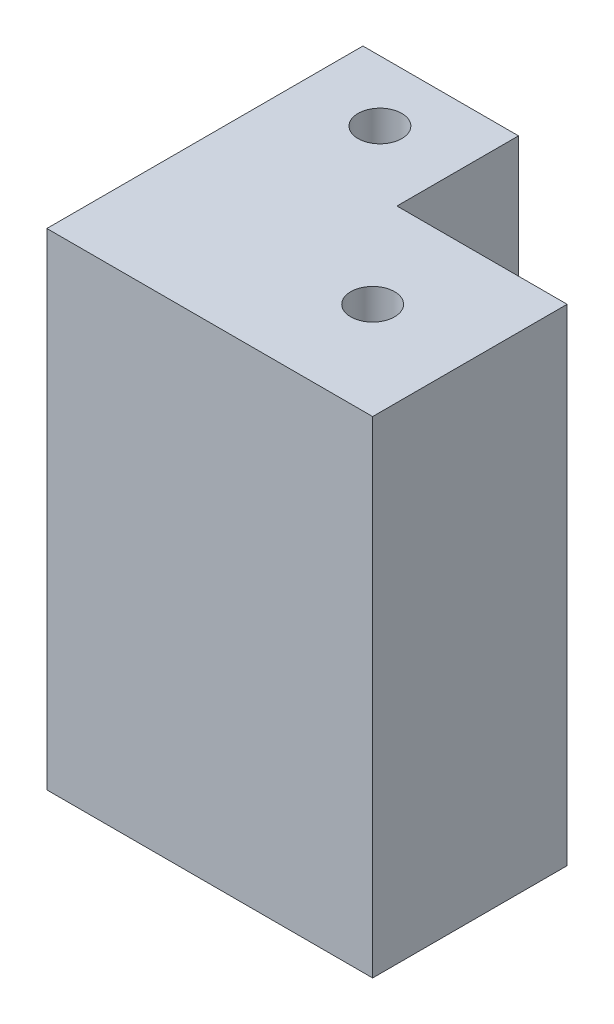
from build123d import *

# Parameters (mm, degrees)
SKETCH1_R                               = 4.5
BOSS_EXTRUDE1_DEPTH                     = 100
CBORE_FOR_M5_HEX_HEAD_BOLT2_D           = 13.5
CBORE_FOR_M5_HEX_HEAD_BOLT2_DEPTH       = 23.85
CBORE_FOR_M5_HEX_HEAD_BOLT2_CBORE_D     = 32
CBORE_FOR_M5_HEX_HEAD_BOLT2_CBORE_DEPTH = 5
CBORE_FOR_M5_HEX_HEAD_BOLT3_D           = 10.2
CBORE_FOR_M5_HEX_HEAD_BOLT3_DEPTH       = 13.5
CBORE_FOR_M5_HEX_HEAD_BOLT3_CBORE_D     = 22
CBORE_FOR_M5_HEX_HEAD_BOLT3_CBORE_DEPTH = 3.5


with BuildPart() as part:
    # Sketch1 → Boss-Extrude1 (new body)
    with BuildSketch(Plane(origin=(0, 0, 0), x_dir=(1, 0, 0), z_dir=(0, 1, 0))):
        Polygon((0, 0), (0, 25), (-32, 25), (-32, -40), (35, -40), (35, 0), align=None)
        with Locations((-16, 12.5)):
            Circle(SKETCH1_R, mode=Mode.SUBTRACT)
        with Locations((15, -20)):
            Circle(SKETCH1_R, mode=Mode.SUBTRACT)
    extrude(amount=BOSS_EXTRUDE1_DEPTH)

    # CBORE for M5 Hex Head Bolt2
    with Locations(Plane(origin=(0, 0, 0), x_dir=(-1, 0, 0), z_dir=(0, -1, 0))):
        with Locations((-15, -20)):
            CounterBoreHole(CBORE_FOR_M5_HEX_HEAD_BOLT2_D / 2, CBORE_FOR_M5_HEX_HEAD_BOLT2_CBORE_D / 2, CBORE_FOR_M5_HEX_HEAD_BOLT2_CBORE_DEPTH, depth=CBORE_FOR_M5_HEX_HEAD_BOLT2_DEPTH)

    # CBORE for M5 Hex Head Bolt3
    with Locations(Plane(origin=(0, 0, 0), x_dir=(-1, 0, 0), z_dir=(0, -1, 0))):
        with Locations((16, 12.5)):
            CounterBoreHole(CBORE_FOR_M5_HEX_HEAD_BOLT3_D / 2, CBORE_FOR_M5_HEX_HEAD_BOLT3_CBORE_D / 2, CBORE_FOR_M5_HEX_HEAD_BOLT3_CBORE_DEPTH, depth=CBORE_FOR_M5_HEX_HEAD_BOLT3_DEPTH)


solid = part.part
